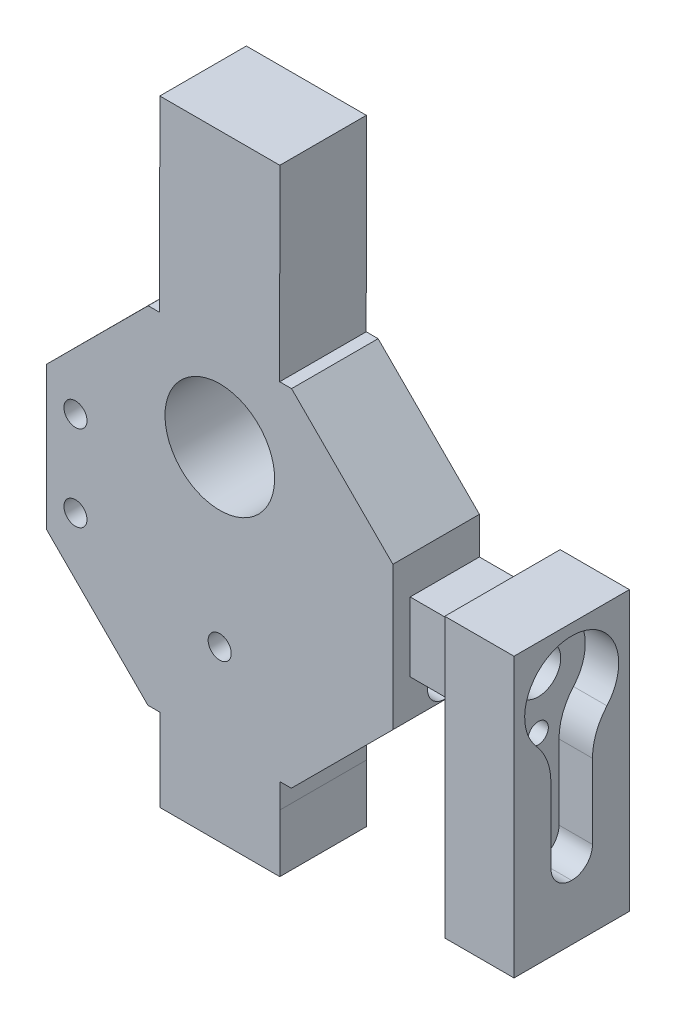
from build123d import *

# Parameters (mm, degrees)
SKETCH1_W            = 20
SKETCH1_H            = 20
BOSS_EXTRUDE1_DEPTH  = 20
SKETCH2_W            = 45
SKETCH2_H            = 70
BOSS_EXTRUDE2_DEPTH  = 12
CUT_EXTRUDE1_DEPTH   = 5.8
FILLET1_R            = 3.6
FILLET2_R            = 10
SKETCH5_R            = 3.9
CUT_EXTRUDE2_DEPTH   = 53.490475326
CUT_EXTRUDE3_REACH   = 51.17
SKETCH6_R            = 1.75
SKETCH7_W            = 12
SKETCH7_H            = 45
CUT_EXTRUDE4_DEPTH   = 4.8
SKETCH9_W            = 12
SKETCH9_H            = 45
CUT_EXTRUDE5_DEPTH   = 23.8
SKETCH10_W           = 12.5
SKETCH10_H           = 41.4
CUT_EXTRUDE6_DEPTH   = 23.8
SKETCH11_W           = 20
SKETCH11_H           = 1.2
CUT_EXTRUDE7_DEPTH   = 23.8
BOSS_EXTRUDE3_START  = 20
SKETCH12_W           = 20
SKETCH12_H           = 20
SKETCH12_R           = 3.9
BOSS_EXTRUDE3_DEPTH  = 20
SKETCH13_W           = 20.2
SKETCH13_H           = 20.2
SKETCH13_R           = 3.9
BOSS_EXTRUDE4_DEPTH  = 40
SKETCH14_W           = 12
SKETCH14_H           = 20
BOSS_EXTRUDE5_DEPTH  = 0.1
SKETCH17_R           = 4.83091966
BOSS_EXTRUDE8_DEPTH  = 39
SKETCH18_W           = 20.2
SKETCH18_H           = 20.2
CUT_EXTRUDE8_DEPTH   = 40
SKETCH20_W           = 12
SKETCH20_H           = 20
BOSS_EXTRUDE9_DEPTH  = 8
SKETCH21_W           = 12
SKETCH21_H           = 12
BOSS_EXTRUDE10_DEPTH = 40
BOSS_EXTRUDE11_DEPTH = 15
SKETCH27_R           = 2
SKETCH27_R_2         = 9.5
CUT_EXTRUDE10_DEPTH  = 65.931708229
BOSS_EXTRUDE12_DEPTH = 38.2
BOSS_EXTRUDE13_REACH = 117.263
SKETCH29_W           = 20.800005304
SKETCH29_H           = 15
BOSS_EXTRUDE14_START = -6
BOSS_EXTRUDE14_DEPTH = 15
SKETCH33_W           = 20.8
SKETCH33_H           = 10
BOSS_EXTRUDE15_DEPTH = 8.09
SKETCH34_W           = 20.8
SKETCH34_H           = 10
BOSS_EXTRUDE16_DEPTH = 27.8
SKETCH35_W           = 20.8
SKETCH35_H           = 96.79
CUT_EXTRUDE11_DEPTH  = 38.2
SKETCH36_W           = 20.800010608
SKETCH36_H           = 15
BOSS_EXTRUDE17_DEPTH = 10
CUT_EXTRUDE12_DEPTH  = 82.628035964
SKETCH39_R           = 3
CUT_EXTRUDE13_DEPTH  = 80


# Read off the part's stored shape, not the designer's step: Boss-Extrude14
with BuildPart() as part:
    # Sketch1 → Boss-Extrude1 (new body)
    with BuildSketch(Plane(origin=(0, 0, 0), x_dir=(0, 0, -1), z_dir=(1, 0, 0))):
        Rectangle(SKETCH1_W, SKETCH1_H)
    extrude(amount=BOSS_EXTRUDE1_DEPTH)

    # Sketch2 → Boss-Extrude2 (add)
    with BuildSketch(Plane(origin=(20, 0, 0), x_dir=(0, 0, -1), z_dir=(1, 0, 0))):
        Rectangle(SKETCH2_W, SKETCH2_H)
    extrude(amount=BOSS_EXTRUDE2_DEPTH)

    # Sketch4 → Cut-Extrude1 (cut)
    with BuildSketch(Plane(origin=(32, 0, 0), x_dir=(0, 0, -1), z_dir=(1, 0, 0))):
        with BuildLine():
            Line((3.6, -28.55), (-3.6, -28.55))
            Line((-3.6, -28.55), (-3.6, -7.311805523))
            ThreePointArc((-3.6, -7.311805523), (0, 8.15), (3.6, -7.311805523))
            Line((3.6, -7.311805523), (3.6, -28.55))
        make_face()
    extrude(amount=-CUT_EXTRUDE1_DEPTH, mode=Mode.SUBTRACT)

    # Fillet1
    fillet1_edges = [part.edges().sort_by_distance(p)[0] for p in [
        (29.1, -28.55, 3.6),
        (29.1, -28.55, -3.6),
    ]]
    fillet(fillet1_edges, radius=FILLET1_R - 0.0001)  # a hair under: the kernel refuses the full size

    # Fillet2
    fillet2_edges = [part.edges().sort_by_distance(p)[0] for p in [
        (29.1, -7.311805523, 3.6),
        (29.1, -7.311805523, -3.6),
    ]]
    fillet(fillet2_edges, radius=FILLET2_R)

    # Sketch5 → Cut-Extrude2 (cut, through all)
    with BuildSketch(Plane.ZY):
        Circle(SKETCH5_R)
    extrude(amount=-CUT_EXTRUDE2_DEPTH, mode=Mode.SUBTRACT)

    # Sketch6 → Cut-Extrude3 (cut, up to next)
    with BuildSketch(Plane(origin=(26.2, 0, 0), x_dir=(0, 0, -1), z_dir=(1, 0, 0)), mode=Mode.PRIVATE) as cut_extrude3_sk1:
        with Locations((0, -20.6)):
            Circle(SKETCH6_R)
    cut_extrude3_tool1 = extrude(cut_extrude3_sk1.sketch, amount=-CUT_EXTRUDE3_REACH, mode=Mode.PRIVATE) & part.part
    # Sketch6 → Cut-Extrude3 (cut, up to next)
    with BuildSketch(Plane(origin=(26.2, 0, 0), x_dir=(0, 0, -1), z_dir=(1, 0, 0)), mode=Mode.PRIVATE) as cut_extrude3_sk2:
        with Locations((0, -9.35)):
            Circle(SKETCH6_R)
    cut_extrude3_tool2 = extrude(cut_extrude3_sk2.sketch, amount=-CUT_EXTRUDE3_REACH, mode=Mode.PRIVATE) & part.part
    add(cut_extrude3_tool1.solids().sort_by_distance((26.2, -20.6, 0))[0], mode=Mode.SUBTRACT)
    add(cut_extrude3_tool2.solids().sort_by_distance((26.2, -9.35, 0))[0], mode=Mode.SUBTRACT)

    # Sketch7 → Cut-Extrude4 (cut)
    with BuildSketch(Plane.XZ.offset(35)):
        with Locations((26, 0)):
            Rectangle(SKETCH7_W, SKETCH7_H)
    extrude(amount=-CUT_EXTRUDE4_DEPTH, mode=Mode.SUBTRACT)

    # Sketch9 → Cut-Extrude5 (cut)
    with BuildSketch(Plane(origin=(0, 35, 0), x_dir=(1, 0, 0), z_dir=(0, 1, 0))):
        with Locations((26, 0)):
            Rectangle(SKETCH9_W, SKETCH9_H)
    extrude(amount=-CUT_EXTRUDE5_DEPTH, mode=Mode.SUBTRACT)

    # Sketch10 → Cut-Extrude6 (cut)
    with BuildSketch(Plane.ZY.offset(-20)):
        with Locations((-16.25, -9.5)):
            Rectangle(SKETCH10_W, SKETCH10_H)
        with Locations((16.25, -9.5)):
            Rectangle(SKETCH10_W, SKETCH10_H)
    extrude(amount=-CUT_EXTRUDE6_DEPTH, mode=Mode.SUBTRACT)

    # Sketch11 → Cut-Extrude7 (cut)
    with BuildSketch(Plane.ZY.offset(-20)):
        with Locations((0, 10.6)):
            Rectangle(SKETCH11_W, SKETCH11_H)
    extrude(amount=-CUT_EXTRUDE7_DEPTH, mode=Mode.SUBTRACT)

    # Sketch12 → Boss-Extrude3 (add)
    with BuildSketch(Plane.ZY.offset(BOSS_EXTRUDE3_START)):
        Rectangle(SKETCH12_W, SKETCH12_H)
        Circle(SKETCH12_R, mode=Mode.SUBTRACT)
    extrude(amount=-BOSS_EXTRUDE3_DEPTH)

    # Sketch13 → Boss-Extrude4 (add)
    with BuildSketch(Plane.ZY.offset(20)):
        Rectangle(SKETCH13_W, SKETCH13_H)
        Circle(SKETCH13_R, mode=Mode.SUBTRACT)
    extrude(amount=-BOSS_EXTRUDE4_DEPTH)

    # Sketch14 → Boss-Extrude5 (add)
    with BuildSketch(Plane(origin=(0, 10, 0), x_dir=(1, 0, 0), z_dir=(0, 1, 0))):
        with Locations((26, 0)):
            Rectangle(SKETCH14_W, SKETCH14_H)
    extrude(amount=BOSS_EXTRUDE5_DEPTH)

    # Sketch17 → Boss-Extrude8 (add)
    with BuildSketch(Plane.ZY.offset(20)):
        Circle(SKETCH17_R)
    extrude(amount=-BOSS_EXTRUDE8_DEPTH)

    # Sketch18 → Cut-Extrude8 (cut)
    with BuildSketch(Plane.ZY.offset(20)):
        Rectangle(SKETCH18_W, SKETCH18_H)
    extrude(amount=-CUT_EXTRUDE8_DEPTH, mode=Mode.SUBTRACT)

    # Sketch20 → Boss-Extrude9 (add)
    with BuildSketch(Plane.XZ.offset(30.2)):
        with Locations((26, 0)):
            Rectangle(SKETCH20_W, SKETCH20_H)
    extrude(amount=BOSS_EXTRUDE9_DEPTH)

    # Sketch21 → Boss-Extrude10 (add)
    with BuildSketch(Plane.ZY.offset(-20)):
        Rectangle(SKETCH21_W, SKETCH21_H)
    extrude(amount=BOSS_EXTRUDE10_DEPTH)

    # Sketch22 → Boss-Extrude11 (add)
    with BuildSketch(Plane(origin=(0, 0, -6), x_dir=(-1, 0, 0), z_dir=(0, 0, -1))):
        Polygon((49.991118151, 12.447827913), (32.404979492, 30.008866549), (7.552172087, 29.991118151), (-10.008866549, 12.404979492), (-9.991118151, -12.447827913), (7.595020508, -30.008866549), (32.447827913, -29.991118151), (50.008866549, -12.404979492), align=None)
    extrude(amount=-BOSS_EXTRUDE11_DEPTH)

    # Sketch27 → Cut-Extrude10 (cut, through all)
    with BuildSketch(Plane(origin=(0, 0, -6), x_dir=(-1, 0, 0), z_dir=(0, 0, -1))):
        with Locations(Location((20.010712105, -14.999996175, 0), (0, 0, 90))):
            Circle(SKETCH27_R)
        with Locations(Location((19.989287895, 14.999996175, 0), (0, 0, 90))):
            Circle(SKETCH27_R_2)
    extrude(amount=-CUT_EXTRUDE10_DEPTH, mode=Mode.SUBTRACT)

    # Sketch26 → Boss-Extrude12 (add)
    with BuildSketch(Plane.XY.offset(9)):
        Polygon((-30.389287895, 52.499996175), (-19.989287895, 52.499996175), (-9.589287895, 52.499996175), (-9.589287895, 62.499996175), (-30.389287895, 62.499996175), align=None)
        Polygon((-9.589287895, -30.007442362), (-30.389287895, -29.992588238), (-30.389287895, -34.290003825), (-9.589287895, -34.290003825), align=None)
        Polygon((-9.589287895, -24.290003825), (-30.389287895, -24.290003825), (-30.389287895, -29.992588238), (-9.589287895, -30.007442362), align=None)
    extrude(amount=BOSS_EXTRUDE12_DEPTH)


with BuildPart() as boss_extrude12_piece_1:
    # of the separate pieces the step leaves, piece 1, a body of its own (boss_extrude12_pieces)
    add(part.part.solids().sort_by_distance((32, -38.2, -10))[0])

    # Boss-Extrude13: up to this plane
    boss_extrude13_end = Plane(origin=(0, -34.290003825, 47.2), z_dir=(0, 1, 0))
    # Sketch29 → Boss-Extrude13 (add, up to the surface)
    with BuildSketch(Plane(origin=(-0.021434411, -30.014275154, 0), x_dir=(0.999999745001739, -0.0007141403622172189, 0), z_dir=(-0.0007141403622172189, -0.999999745001739, 0)), mode=Mode.PRIVATE) as boss_extrude13_sk1:
        with Locations((-19.967858576, 1.5)):
            Rectangle(SKETCH29_W, SKETCH29_H)
    boss_extrude13_tool1 = split(extrude(boss_extrude13_sk1.sketch, amount=BOSS_EXTRUDE13_REACH, mode=Mode.PRIVATE), bisect_by=boss_extrude13_end, keep=Keep.BOTH, mode=Mode.PRIVATE)
    add(boss_extrude13_tool1.solids().sort_by_distance((-19.989288, -30.000015, 1.5))[0])



with BuildPart() as boss_extrude12_piece_2:
    # of the separate pieces the step leaves, piece 2, a body of its own (boss_extrude12_pieces)
    add(part.part.solids().sort_by_distance((-9.589287895, 62.499996175, 9))[0])


with BuildPart() as boss_extrude12_piece_1_1:
    add(boss_extrude12_piece_1.part)

    add(boss_extrude12_piece_2.part)  # Boss-Extrude14 merges Boss-Extrude12 piece 2
    # Boss-Extrude14 outline → Boss-Extrude14 (add)
    with BuildSketch(Plane.XY.offset(BOSS_EXTRUDE14_START)):
        Polygon((-9.612171561, 29.99258928), (-9.588956704, 62.499996175), (-30.391775751, 62.499996175), (-30.414979999, 30.007445409), align=None)
    extrude(amount=BOSS_EXTRUDE14_DEPTH)

    # Sketch33 → Boss-Extrude15 (add)
    with BuildSketch(Plane(origin=(0, -24.290003825, 0), x_dir=(1, 0, 0), z_dir=(0, 1, 0))):
        with Locations((-19.989287895, -42.2)):
            Rectangle(SKETCH33_W, SKETCH33_H)
    extrude(amount=BOSS_EXTRUDE15_DEPTH)

    # Sketch34 → Boss-Extrude16 (add)
    with BuildSketch(Plane.XZ.offset(-52.499996175)):
        with Locations((-19.989287895, 42.2)):
            Rectangle(SKETCH34_W, SKETCH34_H)
    extrude(amount=BOSS_EXTRUDE16_DEPTH)

    # Sketch35 → Cut-Extrude11 (cut)
    with BuildSketch(Plane.XY.offset(47.2)):
        with Locations((-19.989287895, 14.104996175)):
            Rectangle(SKETCH35_W, SKETCH35_H)
    extrude(amount=-CUT_EXTRUDE11_DEPTH, mode=Mode.SUBTRACT)

    # Sketch36 → Boss-Extrude17 (add)
    with BuildSketch(Plane.XZ.offset(34.290003825)):
        with Locations((-19.992351549, 1.5)):
            Rectangle(SKETCH36_W, SKETCH36_H)
    extrude(amount=BOSS_EXTRUDE17_DEPTH)

    # Sketch38 → Cut-Extrude12 (cut, through all)
    with BuildSketch(Plane(origin=(0, 0, -6), x_dir=(-1, 0, 0), z_dir=(0, 0, -1))):
        with BuildLine():
            ThreePointArc((45.008866549, -5.404979492), (43.008866549, -7.404979492), (45.008866549, -9.404979492))
            Line((45.008866549, -9.404979492), (45.008866549, -7.404979492))
            Line((45.008866549, -7.404979492), (45.008866549, -5.404979492))
        make_face()
        with BuildLine():
            Line((45.008866549, -7.404979492), (45.008866549, -9.404979492))
            ThreePointArc((45.008866549, -9.404979492), (46.423080111, -8.819193054), (47.008866549, -7.404979492))
            ThreePointArc((47.008866549, -7.404979492), (46.423080111, -5.990765929), (45.008866549, -5.404979492))
            Line((45.008866549, -5.404979492), (45.008866549, -7.404979492))
        make_face()
        with BuildLine():
            ThreePointArc((45.008866549, 9.438738179), (43.008866549, 7.438738179), (45.008866549, 5.438738179))
            Line((45.008866549, 5.438738179), (45.008866549, 7.438738179))
            Line((45.008866549, 7.438738179), (45.008866549, 9.438738179))
        make_face()
        with BuildLine():
            Line((45.008866549, 7.438738179), (45.008866549, 5.438738179))
            ThreePointArc((45.008866549, 5.438738179), (46.423080111, 6.024524616), (47.008866549, 7.438738179))
            ThreePointArc((47.008866549, 7.438738179), (46.423080111, 8.852951741), (45.008866549, 9.438738179))
            Line((45.008866549, 9.438738179), (45.008866549, 7.438738179))
        make_face()
    extrude(amount=-CUT_EXTRUDE12_DEPTH, mode=Mode.SUBTRACT)

    # Sketch39 → Cut-Extrude13 (cut)
    with BuildSketch(Plane.ZY.offset(-20)):
        with Locations(Location((0, -20.6, 0), (0, 0, 90))):
            Circle(SKETCH39_R)
        with Locations(Location((0, -9.35, 0), (0, 0, 90))):
            Circle(SKETCH39_R)
    extrude(amount=CUT_EXTRUDE13_DEPTH, mode=Mode.SUBTRACT)


solid = boss_extrude12_piece_1_1.part
